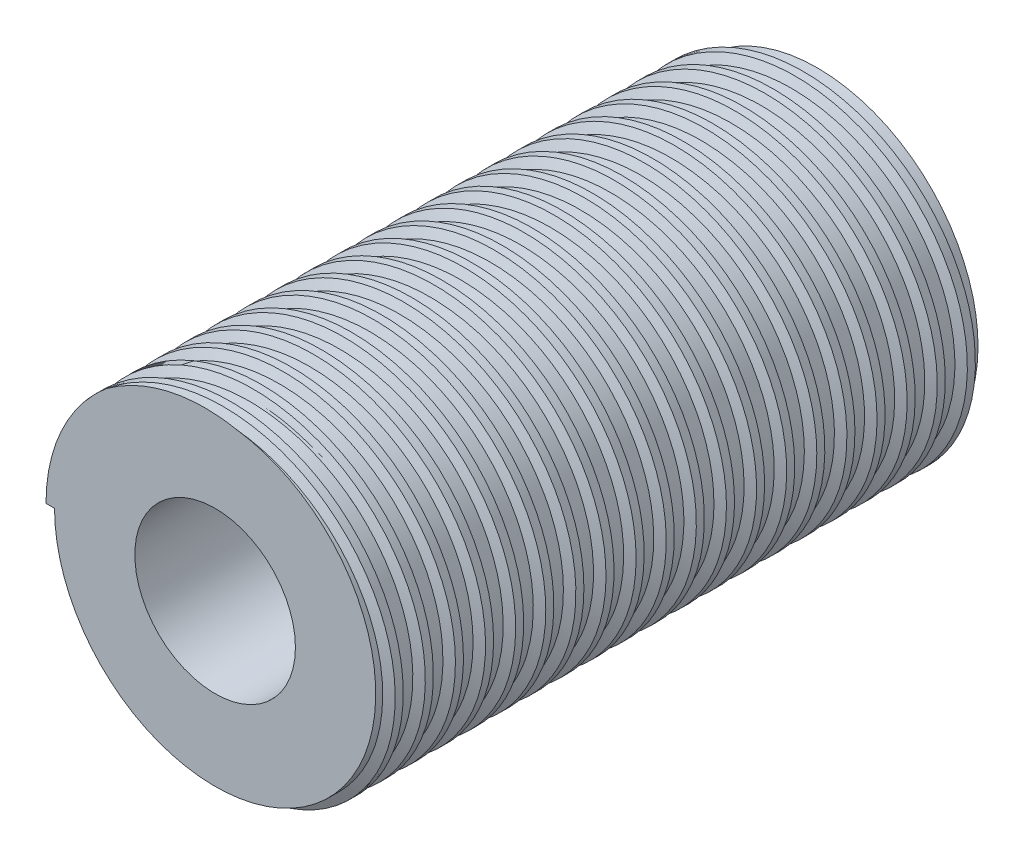
from build123d import *

# Parameters (mm, degrees)
SKETCH1_R           = 8
SKETCH1_R_2         = 6
BOSS_EXTRUDE1_DEPTH = 30
SWEEP1_PITCH        = 1.5
SKETCH4_R           = 9.262082207
CUT_EXTRUDE1_DEPTH  = 25
SKETCH5_R           = 14.464187044
CUT_EXTRUDE2_DEPTH  = 25
BOSS_EXTRUDE2_START = -20
SKETCH6_R           = 6
SKETCH6_R_2         = 4
BOSS_EXTRUDE2_DEPTH = 20


with BuildPart() as part:
    # Sketch1 → Boss-Extrude1 (new body)
    with BuildSketch(Plane.XY):
        Circle(SKETCH1_R)
        Circle(SKETCH1_R_2, mode=Mode.SUBTRACT)
    extrude(amount=BOSS_EXTRUDE1_DEPTH)

    # Sweep1: arcs per turn and ends read off the stored shape
    # Sweep1: the profile of Sketch3 screwed along a right-hand helix through 20 turns, 8 arcs to a turn; built about Z, then put on its axis
    sweep1_z = Axis((0, 0, 0), (0, 0, 1))
    sweep1_corners = [(7.995457473, 0, -0.391997711), (7.995457473, 0, 0.408002289), (8.424358857, 0, 0.208002289), (8.424358857, 0, -0.191997711)]
    with BuildLine(mode=Mode.PRIVATE) as sweep1_profile:
        Line(sweep1_corners[0], sweep1_corners[1])
        Line(sweep1_corners[1], sweep1_corners[2])
        Line(sweep1_corners[2], sweep1_corners[3])
        Line(sweep1_corners[3], sweep1_corners[0])
    sweep1_cap = Face(sweep1_profile.wire())
    sweep1_turn_angles = [0, 22.5, 45, 67.5, 90, 112.5, 135, 157.5, 180, 202.5, 225, 247.5, 270, 292.5, 315, 337.5, 360]
    sweep1_turn_weights = [1, 0.9238795325112867, 1, 0.9238795325112867, 1, 0.9238795325112867, 1, 0.9238795325112867, 1, 0.9238795325112867, 1, 0.9238795325112867, 1, 0.9238795325112867, 1, 0.9238795325112867, 1]
    sweep1_turn_rails = [Edge.make_bspline([Vector(p[0], p[1], 0).rotate(sweep1_z, sweep1_turn_angles[k]) / sweep1_turn_weights[k] + Vector(0, 0, p[2] + SWEEP1_PITCH * sweep1_turn_angles[k] / 360) for k in range(17)], [0, 0, 0, 1, 1, 2, 2, 3, 3, 4, 4, 5, 5, 6, 6, 7, 7, 8, 8, 8], 2, sweep1_turn_weights) for p in sweep1_corners]
    sweep1_turn_sides = [Face.make_surface_from_curves(sweep1_turn_rails[p[0]], sweep1_turn_rails[p[1]]) for p in [(0, 1), (1, 2), (2, 3), (3, 0)]]
    sweep1 = Plane(origin=(0, 0, 0), x_dir=(-1, 0, 0), z_dir=(0, 0, 1)) * Solid(Shell([*[p.moved(Location((0, 0, SWEEP1_PITCH * i))) for i in range(20) for p in sweep1_turn_sides], sweep1_cap, sweep1_cap.rotate(sweep1_z, 7200).moved(Location((0, 0, SWEEP1_PITCH * 7200 / 360)))]))
    add(sweep1)

    # Sketch4 → Cut-Extrude1 (cut)
    with BuildSketch(Plane.XY.offset(30)):
        Circle(SKETCH4_R)
    extrude(amount=CUT_EXTRUDE1_DEPTH, mode=Mode.SUBTRACT)

    # Sketch5 → Cut-Extrude2 (cut)
    with BuildSketch(Plane(origin=(0, 0, 0), x_dir=(-1, 0, 0), z_dir=(0, 0, -1))):
        Circle(SKETCH5_R)
    extrude(amount=CUT_EXTRUDE2_DEPTH, mode=Mode.SUBTRACT)

    # Sketch6 → Boss-Extrude2 (add)
    with BuildSketch(Plane.XY.offset(30).offset(BOSS_EXTRUDE2_START)):
        Circle(SKETCH6_R)
        Circle(SKETCH6_R_2, mode=Mode.SUBTRACT)
    extrude(amount=BOSS_EXTRUDE2_DEPTH)


solid = part.part
